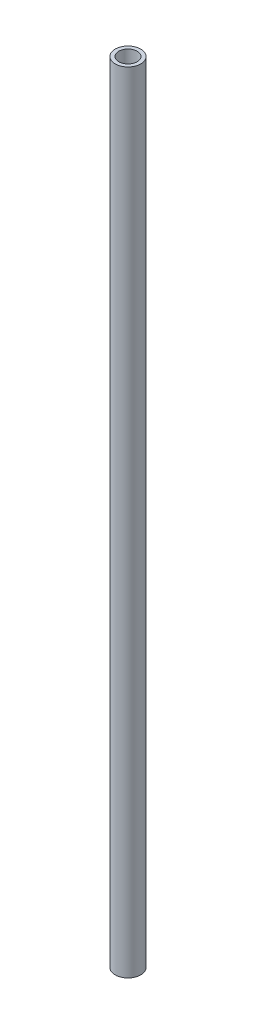
from build123d import *

# Parameters (mm, degrees)
SKETCH1_R           = 3.5
SKETCH1_R_2         = 2.5
BOSS_EXTRUDE1_DEPTH = 107.5


with BuildPart() as part:
    # Sketch1 → Boss-Extrude1 (new, symmetric)
    with BuildSketch(Plane(origin=(0, 0, 0), x_dir=(1, 0, 0), z_dir=(0, 1, 0))):
        Circle(SKETCH1_R)
        Circle(SKETCH1_R_2, mode=Mode.SUBTRACT)
    extrude(amount=BOSS_EXTRUDE1_DEPTH, both=True)


solid = part.part
